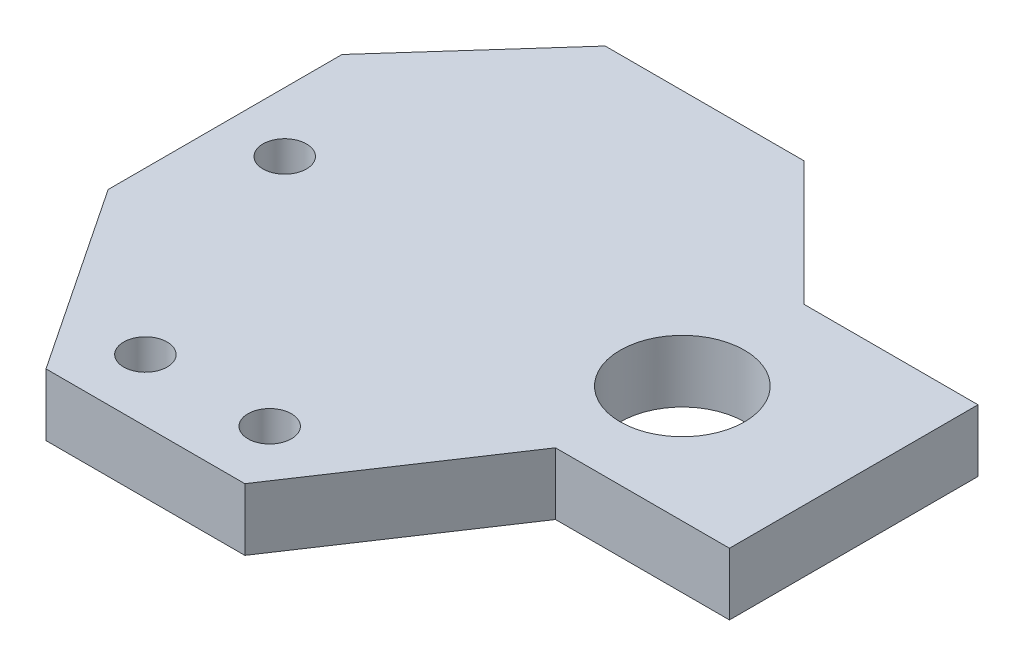
from build123d import *

# Parameters (mm, degrees)
SKETCH1_R           = 1.75
BOSS_EXTRUDE1_DEPTH = 5
SKETCH2_R           = 1.75
SKETCH2_R_2         = 5
CUT_EXTRUDE1_DEPTH  = 10


with BuildPart() as part:
    # Sketch1 → Boss-Extrude1 (new body)
    with BuildSketch(Plane(origin=(0, 0, 0), x_dir=(1, 0, 0), z_dir=(0, 1, 0))):
        Polygon((10, 45), (0, 33.819660113), (0, 15), (10, 0), (26, 0), (36, 15), (50, 15), (50, 35), (36, 35), (26, 45), align=None)
        with Locations((13, 5)):
            Circle(SKETCH1_R, mode=Mode.SUBTRACT)
        with Locations((23, 5)):
            Circle(SKETCH1_R, mode=Mode.SUBTRACT)
    extrude(amount=BOSS_EXTRUDE1_DEPTH)

    # Sketch2 → Cut-Extrude1 (cut)
    with BuildSketch(Plane(origin=(0, 0, 0), x_dir=(-1, 0, 0), z_dir=(0, -1, 0))):
        with Locations((-4.8, 24.409830056)):
            Circle(SKETCH2_R)
        with Locations((-36.8, 24.409830056)):
            Circle(SKETCH2_R_2)
    extrude(amount=-CUT_EXTRUDE1_DEPTH, mode=Mode.SUBTRACT)


solid = part.part
